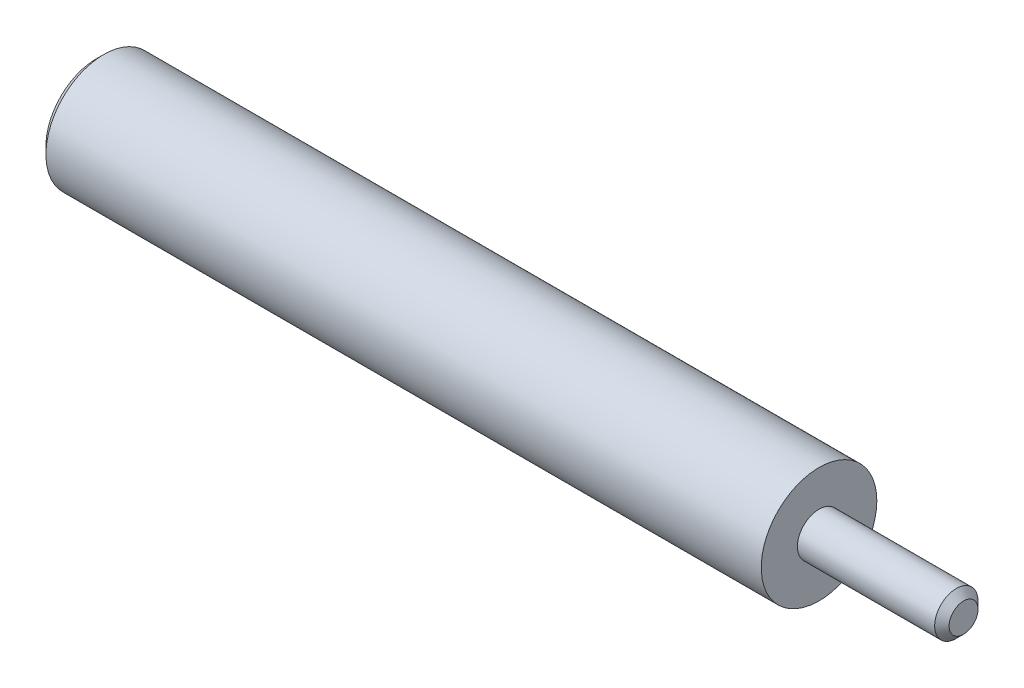
from build123d import *

# Parameters (mm, degrees)
CROQUIS1_R              = 4
SALIENTE_EXTRUIR1_DEPTH = 50
CROQUIS2_R              = 1.5
SALIENTE_EXTRUIR2_DEPTH = 10
CHAFL_N1_SIZE           = 0.5
CHAFL_N2_SIZE           = 0.5


with BuildPart() as part:
    # Croquis1 → Saliente-Extruir1 (new body)
    with BuildSketch(Plane(origin=(0, 0, 0), x_dir=(0, 0, -1), z_dir=(1, 0, 0))):
        Circle(CROQUIS1_R)
    extrude(amount=SALIENTE_EXTRUIR1_DEPTH)

    # Croquis2 → Saliente-Extruir2 (add)
    with BuildSketch(Plane(origin=(50, 0, 0), x_dir=(0, 0, -1), z_dir=(1, 0, 0))):
        Circle(CROQUIS2_R)
    extrude(amount=SALIENTE_EXTRUIR2_DEPTH)

    # Chaflán1
    chafl_n1_edges = [part.edges().sort_by_distance(p)[0] for p in [
        (0, 0, 4),
    ]]
    chamfer(chafl_n1_edges, length=CHAFL_N1_SIZE)

    # Chaflán2
    chafl_n2_edges = [part.edges().sort_by_distance(p)[0] for p in [
        (60, 0, 1.5),
    ]]
    chamfer(chafl_n2_edges, length=CHAFL_N2_SIZE)


solid = part.part
